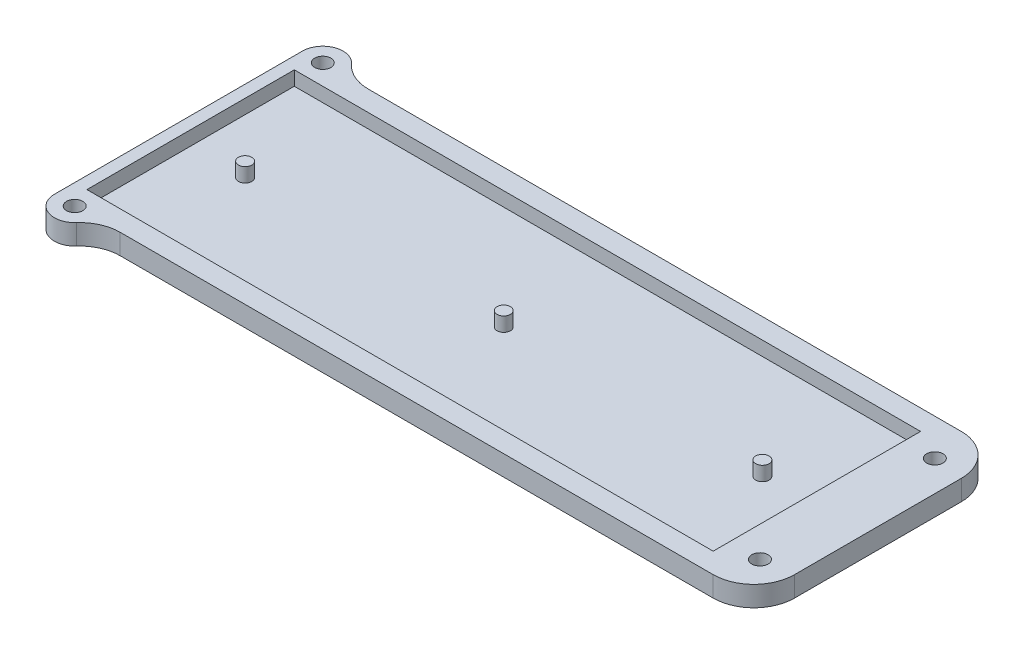
from build123d import *

# Parameters (mm, degrees)
SKETCH2_R           = 2
BOSS_EXTRUDE1_DEPTH = 5
SKETCH3_W           = 154
SKETCH3_H           = 51
SKETCH3_R           = 1.65
CUT_EXTRUDE1_DEPTH  = 3.5
FILLET1_R           = 10


with BuildPart() as part:
    # Sketch2 → Boss-Extrude1 (new body)
    with BuildSketch(Plane(origin=(0, 0, 0), x_dir=(1, 0, 0), z_dir=(0, 1, 0))):
        with BuildLine():
            Line((172, 0), (172, 61))
            Line((172, 61), (10, 61))
            ThreePointArc((10, 61), (5, 66), (0, 61))
            Line((0, 61), (0, 0))
            ThreePointArc((0, 0), (5, -5), (10, 0))
            Line((10, 0), (172, 0))
        make_face()
        with Locations((164.5, 9)):
            Circle(SKETCH2_R, mode=Mode.SUBTRACT)
        with Locations((164.5, 52)):
            Circle(SKETCH2_R, mode=Mode.SUBTRACT)
        with Locations((5, 0)):
            Circle(SKETCH2_R, mode=Mode.SUBTRACT)
        with Locations((5, 61)):
            Circle(SKETCH2_R, mode=Mode.SUBTRACT)
    extrude(amount=BOSS_EXTRUDE1_DEPTH)

    # Sketch3 → Cut-Extrude1 (cut)
    with BuildSketch(Plane(origin=(0, 5, 0), x_dir=(1, 0, 0), z_dir=(0, 1, 0))):
        with Locations((80, 30.5)):
            Rectangle(SKETCH3_W, SKETCH3_H)
        with Locations((80, 30.5)):
            Circle(SKETCH3_R, mode=Mode.SUBTRACT)
        with Locations((16.4, 30.5)):
            Circle(SKETCH3_R, mode=Mode.SUBTRACT)
        with Locations((143.6, 30.5)):
            Circle(SKETCH3_R, mode=Mode.SUBTRACT)
    extrude(amount=-CUT_EXTRUDE1_DEPTH, mode=Mode.SUBTRACT)

    # Fillet1
    fillet1_edges = [part.edges().sort_by_distance(p)[0] for p in [
        (172, 2.5, 0),
        (172, 2.5, -61),
        (10, 2.5, -61),
        (10, 2.5, 0),
    ]]
    fillet(fillet1_edges, radius=FILLET1_R)


solid = part.part
